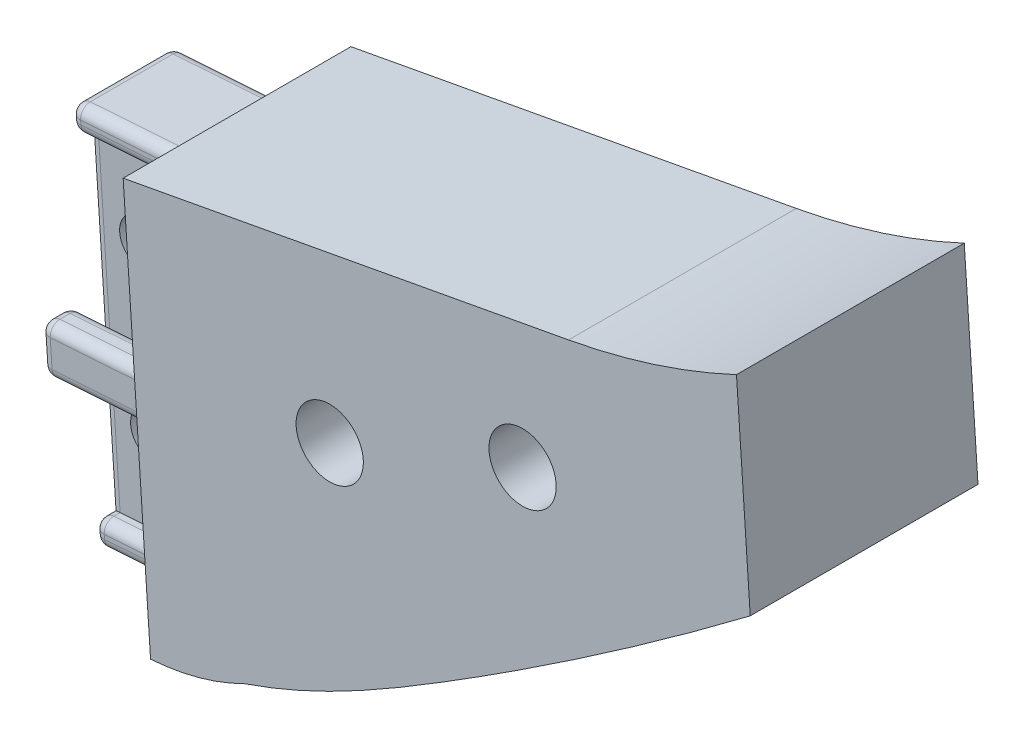
from build123d import *

# Parameters (mm, degrees)
EXTRUDE_1_DEPTH     = 22
SKETCH_2_W          = 6.8
SKETCH_2_H          = 36
SKETCH_2_W_2        = 3
SKETCH_2_H_2        = 4.6
EXTRUDE_2_DEPTH     = 11.3
CUT_EXTRUDE_1_DEPTH = 20
SKETCH_4_R          = 2.25
CUT_EXTRUDE_2_DEPTH = 20
SKETCH_5_W          = 1.6
SKETCH_5_H          = 2.4
EXTRUDE_3_DEPTH     = 11.3
FILLET_1_R          = 1
FILLET_2_R          = 1


with BuildPart() as part:
    # 草图1 → 凸台-拉伸1 (new body)
    with BuildSketch(Plane.XY):
        with BuildLine():
            Line((-45.67470291, -69.525381776), (-46.33853291, -59.768796062))
            Line((-46.33853291, -59.768796062), (-64.634609433, -66.91544134))
            ThreePointArc((-64.634609433, -66.91544134), (-64.468033083, -67.496281171), (-64.411860377, -68.097918284))
            ThreePointArc((-64.411860377, -68.097918284), (-67.060223263, -71.291745578), (-70.68911132, -69.280395229))
            Line((-70.68911132, -69.280395229), (-83.263846009, -74.192222536))
            ThreePointArc((-83.263846009, -74.192222536), (-83.097269659, -74.773062367), (-83.041096953, -75.374699481))
            ThreePointArc((-83.041096953, -75.374699481), (-85.689459839, -78.568526775), (-89.318347897, -76.557176425))
            Line((-89.318347897, -76.557176425), (-104.920333529, -82.651480677))
            Line((-104.920333529, -82.651480677), (-103.596537569, -102.107860688))
            ThreePointArc((-103.596537569, -102.107860688), (-98.935464686, -101.319406189), (-94.522710983, -99.623863303))
            add(Edge.make_bspline(
                [(-94.522710983, -99.623863303), (-94.350413301, -99.565330273), (-94.178323002, -99.505929253), (-92.69861986, -98.987177074), (-91.400233036, -98.477813098), (-88.845034755, -97.380884845), (-87.586146272, -96.792839569), (-85.098419755, -95.553179297), (-83.868933964, -94.901212757), (-80.218918974, -92.877216668), (-77.838192378, -91.438351911), (-75.47271447, -89.973539583)],
                knots=[0, 0, 0, 0, 0.016428629, 0.016428629, 0.141428629, 0.141428629, 0.266428629, 0.266428629, 0.391428629, 0.391428629, 0.641428629, 0.641428629, 0.641428629, 0.641428629], degree=3))
            add(Edge.make_bspline(
                [(-75.47271447, -89.973539583), (-69.114043372, -86.035299041), (-62.877350919, -81.902111218), (-53.019244966, -74.970789332), (-49.323976393, -72.278551115), (-45.67470291, -69.525381776)],
                knots=[0, 0, 0, 0, 0.125, 0.125, 0.201401882, 0.201401882, 0.201401882, 0.201401882], degree=3))
        make_face()
        with BuildLine():
            Line((-46.33853291, -59.768796062), (-47.002362911, -50.012210347))
            add(Edge.make_bspline(
                [(-47.002362911, -50.012210347), (-49.413422482, -51.139640915), (-51.889413625, -52.128282764), (-56.13651362, -53.530307969), (-57.879163461, -54.026452663), (-60.827608618, -54.739002009), (-62.021853835, -54.993542056), (-63.221686051, -55.216067386)],
                knots=[0.829122533, 0.829122533, 0.829122533, 0.829122533, 0.875, 0.875, 0.90625, 0.90625, 0.927296641, 0.927296641, 0.927296641, 0.927296641], degree=3))
            Line((-63.221686051, -55.216067386), (-106.244129489, -63.195100667))
            Line((-106.244129489, -63.195100667), (-104.920333529, -82.651480677))
            Line((-104.920333529, -82.651480677), (-89.318347897, -76.557176425))
            ThreePointArc((-89.318347897, -76.557176425), (-87.473573897, -72.347448537), (-83.263846009, -74.192222536))
            Line((-83.263846009, -74.192222536), (-70.68911132, -69.280395229))
            ThreePointArc((-70.68911132, -69.280395229), (-68.844337321, -65.070667341), (-64.634609433, -66.91544134))
            Line((-64.634609433, -66.91544134), (-46.33853291, -59.768796062))
        make_face()
    extrude(amount=EXTRUDE_1_DEPTH)

    # 草图2 → 凸台-拉伸2 (add)
    with BuildSketch(Plane(origin=(-110.034485921, -7.486655167, 0), x_dir=(0, 0, 1), z_dir=(-0.9976933412560903, -0.06788222752133886, 0))):
        with Locations((11, -75.339968965)):
            Rectangle(SKETCH_2_W, SKETCH_2_H)
        with Locations((18.5, -75.337242964)):
            Rectangle(SKETCH_2_W_2, SKETCH_2_H_2)
        with Locations((3.5, -75.337242964)):
            Rectangle(SKETCH_2_W_2, SKETCH_2_H_2)
    extrude(amount=EXTRUDE_2_DEPTH)

    # 草图3 → 切除-拉伸1 (cut)
    with BuildSketch(Plane(origin=(-121.308420677, -8.253724338, 0), x_dir=(0, 0, 1), z_dir=(-0.9976933412560901, -0.06788222752133916, 0))):
        Polygon((12.5, -72.339968965), (10.433333333, -72.339968965), (11.566666667, -78.339968965), (12.5, -78.339968965), align=None)
        Polygon((11.566666667, -78.339968965), (10.433333333, -72.339968965), (9.5, -72.339968965), (9.5, -78.339968965), align=None)
    extrude(amount=-CUT_EXTRUDE_1_DEPTH, mode=Mode.SUBTRACT)

    # 草图4 → 切除-拉伸2 (cut)
    with BuildSketch(Plane.XY.offset(14.4)):
        with Locations((-110.875766349, -90.876083074)):
            Circle(SKETCH_4_R)
        with Locations((-111.934729099, -75.312066951)):
            Circle(SKETCH_4_R)
    extrude(amount=-CUT_EXTRUDE_2_DEPTH, mode=Mode.SUBTRACT)

    # 草图5 → 凸台-拉伸3 (add)
    with BuildSketch(Plane(origin=(-121.308420677, -8.253724338, 0), x_dir=(0, 0, 1), z_dir=(-0.9976933412560901, -0.06788222752133916, 0))):
        with Locations((15.2, -92.139968965)):
            Rectangle(SKETCH_5_W, SKETCH_5_H)
        with Locations((6.8, -92.139968965)):
            Rectangle(SKETCH_5_W, SKETCH_5_H)
        with Locations((6.8, -58.539968965)):
            Rectangle(SKETCH_5_W, SKETCH_5_H)
        with Locations((15.2, -58.539968965)):
            Rectangle(SKETCH_5_W, SKETCH_5_H)
    extrude(amount=-EXTRUDE_3_DEPTH)

    # 圆角1
    fillet_1_edges = [part.edges().sort_by_distance(p)[0] for p in [
        (-109.498245635, -98.600391243, 16),
        (-109.335328289, -100.994855262, 16),
        (-109.498245635, -98.600391243, 6),
        (-109.335328289, -100.994855262, 6),
        (-111.616171133, -67.472358996, 6),
        (-111.779088479, -65.077894976, 6),
        (-111.779088479, -65.077894976, 16),
        (-111.616171133, -67.472358996, 16),
        (-110.401264308, -85.328350091, 5),
        (-110.713522554, -80.738960722, 5),
        (-110.713522554, -80.738960722, 2),
        (-110.401264308, -85.328350091, 2),
        (-110.401264308, -85.328350091, 17),
        (-110.401264308, -85.328350091, 20),
        (-110.713522554, -80.738960722, 20),
        (-110.713522554, -80.738960722, 17),
        (-106.013595667, -85.734167453, 12.5),
        (-106.013595667, -85.734167453, 9.5),
        (-106.420889032, -79.748007406, 9.5),
        (-106.420889032, -79.748007406, 12.5),
    ]]
    fillet(fillet_1_edges, radius=FILLET_1_R)

    # 圆角2
    # the kernel refuses this fillet: 1 mm, written as the material it takes off along each edge
    with BuildSketch(Plane(origin=(-115.135213013, -98.983925828, 15), x_dir=(0.9976933412560902, 0.06788222752133839, 0), z_dir=(0, 0, -1)), Plane(origin=(-117.253138511, -67.855893581, 14.4), x_dir=(0.9976933412560902, 0.06788222752133742, 0), z_dir=(0, 0, 1)), Plane(origin=(-117.253138511, -67.855893581, 7), x_dir=(0.9976933412560902, 0.06788222752133742, 0), z_dir=(0, 0, 1)), Plane(origin=(-115.135213013, -98.983925828, 7.6), x_dir=(0.9976933412560902, 0.06788222752133839, 0), z_dir=(0, 0, -1))) as fillet_2_piece_1:
        with BuildLine():
            CenterArc((FILLET_2_R, FILLET_2_R), FILLET_2_R, 180, 90)
            Line((0, FILLET_2_R), (-FILLET_2_R * 0.02, FILLET_2_R))
            Line((-FILLET_2_R * 0.02, FILLET_2_R), (-FILLET_2_R * 0.02, -FILLET_2_R * 0.02))
            Line((-FILLET_2_R * 0.02, -FILLET_2_R * 0.02), (FILLET_2_R, -FILLET_2_R * 0.02))
            Line((FILLET_2_R, -FILLET_2_R * 0.02), (FILLET_2_R, 0))
        make_face()
    fillet_2_piece_1_solid = extrude(amount=0.6, mode=Mode.PRIVATE)
    with BuildSketch(Plane(origin=(-115.135213013, -98.983925828, 7.6), x_dir=(0.9976933412560901, 0.06788222752133885, 0), z_dir=(-0.06788222752133886, 0.9976933412560903, 0)), Plane(origin=(-117.253138511, -67.855893581, 14.4), x_dir=(0.9976933412560902, 0.06788222752133886, 0), z_dir=(0.06788222752133886, -0.9976933412560903, 0))) as fillet_2_piece_2:
        with BuildLine():
            CenterArc((FILLET_2_R, -FILLET_2_R), FILLET_2_R, 90, 90)
            Line((0, -FILLET_2_R), (-FILLET_2_R * 0.02, -FILLET_2_R))
            Line((-FILLET_2_R * 0.02, -FILLET_2_R), (-FILLET_2_R * 0.02, FILLET_2_R * 0.02))
            Line((-FILLET_2_R * 0.02, FILLET_2_R * 0.02), (FILLET_2_R, FILLET_2_R * 0.02))
            Line((FILLET_2_R, FILLET_2_R * 0.02), (FILLET_2_R, 0))
        make_face()
    fillet_2_piece_2_solid = extrude(amount=31.2, mode=Mode.PRIVATE)
    with BuildSketch(Plane(origin=(-116.329940217, -81.424523022, 9.5), x_dir=(0, 0, -1), z_dir=(0.06788222752133917, -0.9976933412560902, 0)), Plane(origin=(-116.058411307, -85.415296387, 12.5), x_dir=(0, 0, 1), z_dir=(-0.06788222752133917, 0.9976933412560902, 0))) as fillet_2_piece_3:
        with BuildLine():
            CenterArc((FILLET_2_R, FILLET_2_R), FILLET_2_R, 180, 90)
            Line((0, FILLET_2_R), (-FILLET_2_R * 0.0199999999999, FILLET_2_R))
            Line((-FILLET_2_R * 0.0199999999999, FILLET_2_R), (-FILLET_2_R * 0.02, -FILLET_2_R * 0.02))
            Line((-FILLET_2_R * 0.02, -FILLET_2_R * 0.02), (FILLET_2_R, -FILLET_2_R * 0.02))
            Line((FILLET_2_R, -FILLET_2_R * 0.02), (FILLET_2_R, 0))
        make_face()
    fillet_2_piece_3_solid = extrude(amount=4, mode=Mode.PRIVATE)
    with BuildSketch(Plane(origin=(-116.397822445, -80.426829681, 10.5), x_dir=(-0.0678822275212516, 0.9976933412560962, 0), z_dir=(0, 0, 1)), Plane(origin=(-116.350489932, -81.122495307, 3), x_dir=(0.9976933412560893, 0.06788222752135158, 0), z_dir=(0, 0, 1)), Plane(origin=(-116.038231686, -85.711884677, 4), x_dir=(0.9976933412560893, 0.06788222752135158, 0), z_dir=(0, 0, -1)), Plane(origin=(-116.038231686, -85.711884677, 19), x_dir=(0.9976933412560893, 0.06788222752135158, 0), z_dir=(0, 0, -1)), Plane(origin=(-116.350489932, -81.122495307, 18), x_dir=(0.9976933412560893, 0.06788222752135158, 0), z_dir=(0, 0, 1))) as fillet_2_piece_4:
        with BuildLine():
            CenterArc((FILLET_2_R, -FILLET_2_R), FILLET_2_R, 90, 90)
            Line((0, -FILLET_2_R), (-FILLET_2_R * 0.0199999999999, -FILLET_2_R))
            Line((-FILLET_2_R * 0.0199999999999, -FILLET_2_R), (-FILLET_2_R * 0.02, FILLET_2_R * 0.02))
            Line((-FILLET_2_R * 0.02, FILLET_2_R * 0.02), (FILLET_2_R, FILLET_2_R * 0.02))
            Line((FILLET_2_R, FILLET_2_R * 0.02), (FILLET_2_R, 0))
        make_face()
    fillet_2_piece_4_solid = extrude(amount=1, mode=Mode.PRIVATE)
    with BuildSketch(Plane(origin=(-115.990529079, -86.412989728, 10.5), x_dir=(0.06788222752140816, -0.9976933412560856, 0), z_dir=(0, 0, 1))) as fillet_2_piece_5:
        with BuildLine():
            CenterArc((FILLET_2_R, FILLET_2_R), FILLET_2_R, 180, 90)
            Line((0, FILLET_2_R), (-FILLET_2_R * 0.0199999999999, FILLET_2_R))
            Line((-FILLET_2_R * 0.0199999999999, FILLET_2_R), (-FILLET_2_R * 0.02, -FILLET_2_R * 0.02))
            Line((-FILLET_2_R * 0.02, -FILLET_2_R * 0.02), (FILLET_2_R, -FILLET_2_R * 0.02))
            Line((FILLET_2_R, -FILLET_2_R * 0.02), (FILLET_2_R, 0))
        make_face()
    fillet_2_piece_5_solid = extrude(amount=1, mode=Mode.PRIVATE)
    with BuildSketch(Plane(origin=(-115.040177894, -100.380696506, 16), x_dir=(0.9976933412560902, 0.06788222752133917, 0), z_dir=(-0.06788222752133917, 0.9976933412560902, 0)), Plane(origin=(-117.321020739, -66.85820024, 16), x_dir=(0.9976933412560901, 0.06788222752133916, 0), z_dir=(-0.06788222752133917, 0.9976933412560902, 0)), Plane(origin=(-117.34817363, -66.459122903, 6), x_dir=(0.9976933412560902, 0.06788222752133917, 0), z_dir=(0.06788222752133917, -0.9976933412560902, 0)), Plane(origin=(-115.067330785, -99.981619169, 6), x_dir=(0.9976933412560902, 0.06788222752133917, 0), z_dir=(0.06788222752133917, -0.9976933412560902, 0))) as fillet_2_piece_6:
        with BuildLine():
            CenterArc((FILLET_2_R, FILLET_2_R), FILLET_2_R, 180, 90)
            Line((0, FILLET_2_R), (-FILLET_2_R * 0.02, FILLET_2_R))
            Line((-FILLET_2_R * 0.02, FILLET_2_R), (-FILLET_2_R * 0.02, -FILLET_2_R * 0.02))
            Line((-FILLET_2_R * 0.02, -FILLET_2_R * 0.02), (FILLET_2_R, -FILLET_2_R * 0.02))
            Line((FILLET_2_R, -FILLET_2_R * 0.02), (FILLET_2_R, 0))
        make_face()
    fillet_2_piece_6_solid = extrude(amount=0.4, mode=Mode.PRIVATE)
    with BuildSketch(Plane(origin=(-114.972295667, -101.378389847, 15), x_dir=(0.9976933412560904, 0.06788222752133648, 0), z_dir=(0, 0, -1)), Plane(origin=(-117.416055857, -65.461429562, 7), x_dir=(0.9976933412560884, 0.06788222752136572, 0), z_dir=(0, 0, 1))) as fillet_2_piece_7:
        with BuildLine():
            CenterArc((FILLET_2_R, -FILLET_2_R), FILLET_2_R, 90, 90)
            Line((0, -FILLET_2_R), (-FILLET_2_R * 0.02, -FILLET_2_R))
            Line((-FILLET_2_R * 0.02, -FILLET_2_R), (-FILLET_2_R * 0.02, FILLET_2_R * 0.02))
            Line((-FILLET_2_R * 0.02, FILLET_2_R * 0.02), (FILLET_2_R, FILLET_2_R * 0.02))
            Line((FILLET_2_R, FILLET_2_R * 0.02), (FILLET_2_R, 0))
        make_face()
    fillet_2_piece_7_solid = extrude(amount=8, mode=Mode.PRIVATE)
    with BuildSketch(Plane(origin=(-117.321020739, -66.85820024, 15), x_dir=(0.06788222752133742, -0.9976933412560902, 0), z_dir=(0, 0, -1))) as fillet_2_piece_8:
        with BuildLine():
            CenterArc((1 - FILLET_2_R, -FILLET_2_R), FILLET_2_R, 0, 90)
            Line((1 - FILLET_2_R, 0), (1 - FILLET_2_R, FILLET_2_R * 0.02))
            Line((1 - FILLET_2_R, FILLET_2_R * 0.02), (1, FILLET_2_R * 0.02))
            Line((1, FILLET_2_R * 0.02), (1 + FILLET_2_R * 0.02, 0))
            Line((1 + FILLET_2_R * 0.02, 0), (1 + FILLET_2_R * 0.02, -FILLET_2_R))
            Line((1 + FILLET_2_R * 0.02, -FILLET_2_R), (1, -FILLET_2_R))
        make_face()
    fillet_2_piece_8_solid = revolve(axis=Axis((-117.321020739, -66.85820024, 15), (-0.9976933412560902, -0.06788222752133917, 0)), revolution_arc=90, mode=Mode.PRIVATE)
    with BuildSketch(Plane(origin=(-117.34817363, -66.459122903, 15), x_dir=(-0.06788222752133742, 0.9976933412560902, 0), z_dir=(0, 0, -1))) as fillet_2_piece_9:
        with BuildLine():
            CenterArc((1 - FILLET_2_R, FILLET_2_R), FILLET_2_R, 270, 90)
            Line((1 - FILLET_2_R, 0), (1 - FILLET_2_R, -FILLET_2_R * 0.02))
            Line((1 - FILLET_2_R, -FILLET_2_R * 0.02), (1, -FILLET_2_R * 0.02))
            Line((1, -FILLET_2_R * 0.02), (1 + FILLET_2_R * 0.02, 0))
            Line((1 + FILLET_2_R * 0.02, 0), (1 + FILLET_2_R * 0.02, FILLET_2_R))
            Line((1 + FILLET_2_R * 0.02, FILLET_2_R), (1, FILLET_2_R))
        make_face()
    fillet_2_piece_9_solid = revolve(axis=Axis((-117.34817363, -66.459122903, 15), (0.9976933412560902, 0.06788222752133917, 0)), revolution_arc=90, mode=Mode.PRIVATE)
    with BuildSketch(Plane(origin=(-117.34817363, -66.459122903, 7), x_dir=(0, 0, -1), z_dir=(0.06788222752133917, -0.9976933412560902, -1.4178075122914751e-14))) as fillet_2_piece_10:
        with BuildLine():
            CenterArc((1 - FILLET_2_R, FILLET_2_R), FILLET_2_R, 270, 90)
            Line((1 - FILLET_2_R, 0), (1 - FILLET_2_R, -FILLET_2_R * 0.02))
            Line((1 - FILLET_2_R, -FILLET_2_R * 0.02), (1, -FILLET_2_R * 0.02))
            Line((1, -FILLET_2_R * 0.02), (1 + FILLET_2_R * 0.02, 0))
            Line((1 + FILLET_2_R * 0.02, 0), (1 + FILLET_2_R * 0.02, FILLET_2_R))
            Line((1 + FILLET_2_R * 0.02, FILLET_2_R), (1, FILLET_2_R))
        make_face()
    fillet_2_piece_10_solid = revolve(axis=Axis((-117.34817363, -66.459122903, 7), (0.9976933412560902, 0.06788222752133917, 0)), revolution_arc=90, mode=Mode.PRIVATE)
    with BuildSketch(Plane(origin=(-117.321020739, -66.85820024, 7), x_dir=(0.06788222752133742, -0.9976933412560902, 0), z_dir=(0, 0, 1))) as fillet_2_piece_11:
        with BuildLine():
            CenterArc((1 - FILLET_2_R, FILLET_2_R), FILLET_2_R, 270, 90)
            Line((1 - FILLET_2_R, 0), (1 - FILLET_2_R, -FILLET_2_R * 0.02))
            Line((1 - FILLET_2_R, -FILLET_2_R * 0.02), (1, -FILLET_2_R * 0.02))
            Line((1, -FILLET_2_R * 0.02), (1 + FILLET_2_R * 0.02, 0))
            Line((1 + FILLET_2_R * 0.02, 0), (1 + FILLET_2_R * 0.02, FILLET_2_R))
            Line((1 + FILLET_2_R * 0.02, FILLET_2_R), (1, FILLET_2_R))
        make_face()
    fillet_2_piece_11_solid = revolve(axis=Axis((-117.321020739, -66.85820024, 7), (0.9976933412560902, 0.06788222752133917, 0)), revolution_arc=90, mode=Mode.PRIVATE)
    with BuildSketch(Plane(origin=(-115.067330785, -99.981619169, 7), x_dir=(0, 0, -1), z_dir=(0.06788222752133917, -0.9976933412560902, 0))) as fillet_2_piece_12:
        with BuildLine():
            CenterArc((1 - FILLET_2_R, FILLET_2_R), FILLET_2_R, 270, 90)
            Line((1 - FILLET_2_R, 0), (1 - FILLET_2_R, -FILLET_2_R * 0.02))
            Line((1 - FILLET_2_R, -FILLET_2_R * 0.02), (1, -FILLET_2_R * 0.02))
            Line((1, -FILLET_2_R * 0.02), (1 + FILLET_2_R * 0.02, 0))
            Line((1 + FILLET_2_R * 0.02, 0), (1 + FILLET_2_R * 0.02, FILLET_2_R))
            Line((1 + FILLET_2_R * 0.02, FILLET_2_R), (1, FILLET_2_R))
        make_face()
    fillet_2_piece_12_solid = revolve(axis=Axis((-115.067330785, -99.981619169, 7), (0.9976933412560902, 0.06788222752133917, 0)), revolution_arc=90, mode=Mode.PRIVATE)
    with BuildSketch(Plane(origin=(-115.040177894, -100.380696506, 7), x_dir=(0.06788222752133742, -0.9976933412560902, 0), z_dir=(0, 0, 1))) as fillet_2_piece_13:
        with BuildLine():
            CenterArc((1 - FILLET_2_R, FILLET_2_R), FILLET_2_R, 270, 90)
            Line((1 - FILLET_2_R, 0), (1 - FILLET_2_R, -FILLET_2_R * 0.02))
            Line((1 - FILLET_2_R, -FILLET_2_R * 0.02), (1, -FILLET_2_R * 0.02))
            Line((1, -FILLET_2_R * 0.02), (1 + FILLET_2_R * 0.02, 0))
            Line((1 + FILLET_2_R * 0.02, 0), (1 + FILLET_2_R * 0.02, FILLET_2_R))
            Line((1 + FILLET_2_R * 0.02, FILLET_2_R), (1, FILLET_2_R))
        make_face()
    fillet_2_piece_13_solid = revolve(axis=Axis((-115.040177894, -100.380696506, 7), (0.9976933412560902, 0.06788222752133917, 0)), revolution_arc=90, mode=Mode.PRIVATE)
    with BuildSketch(Plane(origin=(-115.040177894, -100.380696506, 15), x_dir=(0, 0, 1), z_dir=(-0.06788222752133917, 0.9976933412560902, 1.4178075122914751e-14))) as fillet_2_piece_14:
        with BuildLine():
            CenterArc((1 - FILLET_2_R, FILLET_2_R), FILLET_2_R, 270, 90)
            Line((1 - FILLET_2_R, 0), (1 - FILLET_2_R, -FILLET_2_R * 0.02))
            Line((1 - FILLET_2_R, -FILLET_2_R * 0.02), (1, -FILLET_2_R * 0.02))
            Line((1, -FILLET_2_R * 0.02), (1 + FILLET_2_R * 0.02, 0))
            Line((1 + FILLET_2_R * 0.02, 0), (1 + FILLET_2_R * 0.02, FILLET_2_R))
            Line((1 + FILLET_2_R * 0.02, FILLET_2_R), (1, FILLET_2_R))
        make_face()
    fillet_2_piece_14_solid = revolve(axis=Axis((-115.040177894, -100.380696506, 15), (0.9976933412560902, 0.06788222752133917, 0)), revolution_arc=90, mode=Mode.PRIVATE)
    with BuildSketch(Plane(origin=(-115.067330785, -99.981619169, 15), x_dir=(-0.06788222752133742, 0.9976933412560902, 0), z_dir=(0, 0, -1))) as fillet_2_piece_15:
        with BuildLine():
            CenterArc((1 - FILLET_2_R, FILLET_2_R), FILLET_2_R, 270, 90)
            Line((1 - FILLET_2_R, 0), (1 - FILLET_2_R, -FILLET_2_R * 0.02))
            Line((1 - FILLET_2_R, -FILLET_2_R * 0.02), (1, -FILLET_2_R * 0.02))
            Line((1, -FILLET_2_R * 0.02), (1 + FILLET_2_R * 0.02, 0))
            Line((1 + FILLET_2_R * 0.02, 0), (1 + FILLET_2_R * 0.02, FILLET_2_R))
            Line((1 + FILLET_2_R * 0.02, FILLET_2_R), (1, FILLET_2_R))
        make_face()
    fillet_2_piece_15_solid = revolve(axis=Axis((-115.067330785, -99.981619169, 15), (0.9976933412560902, 0.06788222752133917, 0)), revolution_arc=90, mode=Mode.PRIVATE)
    with BuildSketch(Plane(origin=(-116.282607705, -82.120188648, 5), x_dir=(0.9976933412560902, 0.06788222752133885, 0), z_dir=(0.06788222752133886, -0.9976933412560903, 0)), Plane(origin=(-116.106113913, -84.714191336, 2), x_dir=(0.9976933412560902, 0.06788222752133886, 0), z_dir=(-0.06788222752133886, 0.9976933412560903, 0)), Plane(origin=(-116.106113913, -84.714191336, 17), x_dir=(0.9976933412560902, 0.06788222752133886, 0), z_dir=(-0.06788222752133886, 0.9976933412560903, 0)), Plane(origin=(-116.282607705, -82.120188648, 20), x_dir=(0.9976933412560902, 0.06788222752133885, 0), z_dir=(0.06788222752133886, -0.9976933412560903, 0))) as fillet_2_piece_16:
        with BuildLine():
            CenterArc((FILLET_2_R, -FILLET_2_R), FILLET_2_R, 90, 90)
            Line((0, -FILLET_2_R), (-FILLET_2_R * 0.02, -FILLET_2_R))
            Line((-FILLET_2_R * 0.02, -FILLET_2_R), (-FILLET_2_R * 0.02, FILLET_2_R * 0.02))
            Line((-FILLET_2_R * 0.02, FILLET_2_R * 0.02), (FILLET_2_R, FILLET_2_R * 0.02))
            Line((FILLET_2_R, FILLET_2_R * 0.02), (FILLET_2_R, 0))
        make_face()
    fillet_2_piece_16_solid = extrude(amount=2.6, mode=Mode.PRIVATE)
    with BuildSketch(Plane(origin=(-116.282607705, -82.120188648, 3), x_dir=(0, 0, -1), z_dir=(0.06788222752133886, -0.9976933412560902, 0))) as fillet_2_piece_17:
        with BuildLine():
            CenterArc((1 - FILLET_2_R, FILLET_2_R), FILLET_2_R, 270, 90)
            Line((1 - FILLET_2_R, 0), (1 - FILLET_2_R, -FILLET_2_R * 0.02))
            Line((1 - FILLET_2_R, -FILLET_2_R * 0.02), (1, -FILLET_2_R * 0.02))
            Line((1, -FILLET_2_R * 0.02), (1 + FILLET_2_R * 0.02, 0))
            Line((1 + FILLET_2_R * 0.02, 0), (1 + FILLET_2_R * 0.02, FILLET_2_R))
            Line((1 + FILLET_2_R * 0.02, FILLET_2_R), (1, FILLET_2_R))
        make_face()
    fillet_2_piece_17_solid = revolve(axis=Axis((-116.282607705, -82.120188648, 3), (0.9976933412560902, 0.06788222752133886, 0)), revolution_arc=90, mode=Mode.PRIVATE)
    with BuildSketch(Plane(origin=(-116.106113913, -84.714191336, 3), x_dir=(0, 0, -1), z_dir=(-0.06788222752133886, 0.9976933412560902, 0))) as fillet_2_piece_18:
        with BuildLine():
            CenterArc((1 - FILLET_2_R, -FILLET_2_R), FILLET_2_R, 0, 90)
            Line((1 - FILLET_2_R, 0), (1 - FILLET_2_R, FILLET_2_R * 0.02))
            Line((1 - FILLET_2_R, FILLET_2_R * 0.02), (1, FILLET_2_R * 0.02))
            Line((1, FILLET_2_R * 0.02), (1 + FILLET_2_R * 0.02, 0))
            Line((1 + FILLET_2_R * 0.02, 0), (1 + FILLET_2_R * 0.02, -FILLET_2_R))
            Line((1 + FILLET_2_R * 0.02, -FILLET_2_R), (1, -FILLET_2_R))
        make_face()
    fillet_2_piece_18_solid = revolve(axis=Axis((-116.106113913, -84.714191336, 3), (-0.9976933412560902, -0.06788222752133886, 0)), revolution_arc=90, mode=Mode.PRIVATE)
    with BuildSketch(Plane(origin=(-116.106113913, -84.714191336, 4), x_dir=(0, 0, 1), z_dir=(-0.06788222752133886, 0.9976933412560902, 0))) as fillet_2_piece_19:
        with BuildLine():
            CenterArc((1 - FILLET_2_R, FILLET_2_R), FILLET_2_R, 270, 90)
            Line((1 - FILLET_2_R, 0), (1 - FILLET_2_R, -FILLET_2_R * 0.02))
            Line((1 - FILLET_2_R, -FILLET_2_R * 0.02), (1, -FILLET_2_R * 0.02))
            Line((1, -FILLET_2_R * 0.02), (1 + FILLET_2_R * 0.02, 0))
            Line((1 + FILLET_2_R * 0.02, 0), (1 + FILLET_2_R * 0.02, FILLET_2_R))
            Line((1 + FILLET_2_R * 0.02, FILLET_2_R), (1, FILLET_2_R))
        make_face()
    fillet_2_piece_19_solid = revolve(axis=Axis((-116.106113913, -84.714191336, 4), (0.9976933412560902, 0.06788222752133886, 0)), revolution_arc=90, mode=Mode.PRIVATE)
    with BuildSketch(Plane(origin=(-116.282607705, -82.120188648, 4), x_dir=(-0.06788222752133742, 0.9976933412560902, 0), z_dir=(0, 0, -1))) as fillet_2_piece_20:
        with BuildLine():
            CenterArc((1 - FILLET_2_R, FILLET_2_R), FILLET_2_R, 270, 90)
            Line((1 - FILLET_2_R, 0), (1 - FILLET_2_R, -FILLET_2_R * 0.02))
            Line((1 - FILLET_2_R, -FILLET_2_R * 0.02), (1, -FILLET_2_R * 0.02))
            Line((1, -FILLET_2_R * 0.02), (1 + FILLET_2_R * 0.02, 0))
            Line((1 + FILLET_2_R * 0.02, 0), (1 + FILLET_2_R * 0.02, FILLET_2_R))
            Line((1 + FILLET_2_R * 0.02, FILLET_2_R), (1, FILLET_2_R))
        make_face()
    fillet_2_piece_20_solid = revolve(axis=Axis((-116.282607705, -82.120188648, 4), (0.9976933412560902, 0.06788222752133886, 0)), revolution_arc=90, mode=Mode.PRIVATE)
    with BuildSketch(Plane(origin=(-116.282607705, -82.120188648, 19), x_dir=(0, 0, 1), z_dir=(0.06788222752133886, -0.9976933412560902, -1.4178075122914751e-14))) as fillet_2_piece_21:
        with BuildLine():
            CenterArc((1 - FILLET_2_R, -FILLET_2_R), FILLET_2_R, 0, 90)
            Line((1 - FILLET_2_R, 0), (1 - FILLET_2_R, FILLET_2_R * 0.02))
            Line((1 - FILLET_2_R, FILLET_2_R * 0.02), (1, FILLET_2_R * 0.02))
            Line((1, FILLET_2_R * 0.02), (1 + FILLET_2_R * 0.02, 0))
            Line((1 + FILLET_2_R * 0.02, 0), (1 + FILLET_2_R * 0.02, -FILLET_2_R))
            Line((1 + FILLET_2_R * 0.02, -FILLET_2_R), (1, -FILLET_2_R))
        make_face()
    fillet_2_piece_21_solid = revolve(axis=Axis((-116.282607705, -82.120188648, 19), (-0.9976933412560902, -0.06788222752133886, 0)), revolution_arc=90, mode=Mode.PRIVATE)
    with BuildSketch(Plane(origin=(-116.106113913, -84.714191336, 19), x_dir=(0, 0, 1), z_dir=(-0.06788222752133886, 0.9976933412560902, 0))) as fillet_2_piece_22:
        with BuildLine():
            CenterArc((1 - FILLET_2_R, FILLET_2_R), FILLET_2_R, 270, 90)
            Line((1 - FILLET_2_R, 0), (1 - FILLET_2_R, -FILLET_2_R * 0.02))
            Line((1 - FILLET_2_R, -FILLET_2_R * 0.02), (1, -FILLET_2_R * 0.02))
            Line((1, -FILLET_2_R * 0.02), (1 + FILLET_2_R * 0.02, 0))
            Line((1 + FILLET_2_R * 0.02, 0), (1 + FILLET_2_R * 0.02, FILLET_2_R))
            Line((1 + FILLET_2_R * 0.02, FILLET_2_R), (1, FILLET_2_R))
        make_face()
    fillet_2_piece_22_solid = revolve(axis=Axis((-116.106113913, -84.714191336, 19), (0.9976933412560902, 0.06788222752133886, 0)), revolution_arc=90, mode=Mode.PRIVATE)
    with BuildSketch(Plane(origin=(-116.282607705, -82.120188648, 18), x_dir=(0, 0, -1), z_dir=(0.06788222752133886, -0.9976933412560902, 0))) as fillet_2_piece_23:
        with BuildLine():
            CenterArc((1 - FILLET_2_R, FILLET_2_R), FILLET_2_R, 270, 90)
            Line((1 - FILLET_2_R, 0), (1 - FILLET_2_R, -FILLET_2_R * 0.02))
            Line((1 - FILLET_2_R, -FILLET_2_R * 0.02), (1, -FILLET_2_R * 0.02))
            Line((1, -FILLET_2_R * 0.02), (1 + FILLET_2_R * 0.02, 0))
            Line((1 + FILLET_2_R * 0.02, 0), (1 + FILLET_2_R * 0.02, FILLET_2_R))
            Line((1 + FILLET_2_R * 0.02, FILLET_2_R), (1, FILLET_2_R))
        make_face()
    fillet_2_piece_23_solid = revolve(axis=Axis((-116.282607705, -82.120188648, 18), (0.9976933412560902, 0.06788222752133886, 0)), revolution_arc=90, mode=Mode.PRIVATE)
    with BuildSketch(Plane(origin=(-116.106113913, -84.714191336, 18), x_dir=(0.06788222752133742, -0.9976933412560902, 0), z_dir=(0, 0, 1))) as fillet_2_piece_24:
        with BuildLine():
            CenterArc((1 - FILLET_2_R, FILLET_2_R), FILLET_2_R, 270, 90)
            Line((1 - FILLET_2_R, 0), (1 - FILLET_2_R, -FILLET_2_R * 0.02))
            Line((1 - FILLET_2_R, -FILLET_2_R * 0.02), (1, -FILLET_2_R * 0.02))
            Line((1, -FILLET_2_R * 0.02), (1 + FILLET_2_R * 0.02, 0))
            Line((1 + FILLET_2_R * 0.02, 0), (1 + FILLET_2_R * 0.02, FILLET_2_R))
            Line((1 + FILLET_2_R * 0.02, FILLET_2_R), (1, FILLET_2_R))
        make_face()
    fillet_2_piece_24_solid = revolve(axis=Axis((-116.106113913, -84.714191336, 18), (0.9976933412560902, 0.06788222752133886, 0)), revolution_arc=90, mode=Mode.PRIVATE)
    with BuildSketch(Plane(origin=(-116.329940217, -81.424523022, 10.5), x_dir=(0, 0, -1), z_dir=(0.06788222752133917, -0.9976933412560902, -1.4178075122914751e-14))) as fillet_2_piece_25:
        with BuildLine():
            CenterArc((1 + FILLET_2_R, FILLET_2_R), FILLET_2_R, 180, 90)
            Line((1, FILLET_2_R), (1 - FILLET_2_R * 0.02, FILLET_2_R))
            Line((1 - FILLET_2_R * 0.02, FILLET_2_R), (1 - FILLET_2_R * 0.02, -FILLET_2_R * 0.02))
            Line((1 - FILLET_2_R * 0.02, -FILLET_2_R * 0.02), (1 + FILLET_2_R, -FILLET_2_R * 0.02))
            Line((1 + FILLET_2_R, -FILLET_2_R * 0.02), (1 + FILLET_2_R, 0))
        make_face()
    fillet_2_piece_25_solid = revolve(axis=Axis((-116.329940217, -81.424523022, 10.5), (0.9976933412560902, 0.06788222752133917, 0)), revolution_arc=90, mode=Mode.PRIVATE)
    with BuildSketch(Plane(origin=(-116.329940217, -81.424523022, 11.5), x_dir=(0, 0, 1), z_dir=(0.06788222752133917, -0.9976933412560902, 0))) as fillet_2_piece_26:
        with BuildLine():
            CenterArc((1 + FILLET_2_R, -FILLET_2_R), FILLET_2_R, 90, 90)
            Line((1, -FILLET_2_R), (1 - FILLET_2_R * 0.02, -FILLET_2_R))
            Line((1 - FILLET_2_R * 0.02, -FILLET_2_R), (1 - FILLET_2_R * 0.02, FILLET_2_R * 0.02))
            Line((1 - FILLET_2_R * 0.02, FILLET_2_R * 0.02), (1 + FILLET_2_R, FILLET_2_R * 0.02))
            Line((1 + FILLET_2_R, FILLET_2_R * 0.02), (1 + FILLET_2_R, 0))
        make_face()
    fillet_2_piece_26_solid = revolve(axis=Axis((-116.329940217, -81.424523022, 11.5), (-0.9976933412560902, -0.06788222752133917, 0)), revolution_arc=90, mode=Mode.PRIVATE)
    with BuildSketch(Plane(origin=(-116.058411307, -85.415296387, 10.5), x_dir=(0.06788222752133742, -0.9976933412560902, 0), z_dir=(0, 0, 1))) as fillet_2_piece_27:
        with BuildLine():
            CenterArc((1 + FILLET_2_R, FILLET_2_R), FILLET_2_R, 180, 90)
            Line((1, FILLET_2_R), (1 - FILLET_2_R * 0.02, FILLET_2_R))
            Line((1 - FILLET_2_R * 0.02, FILLET_2_R), (1 - FILLET_2_R * 0.02, -FILLET_2_R * 0.02))
            Line((1 - FILLET_2_R * 0.02, -FILLET_2_R * 0.02), (1 + FILLET_2_R, -FILLET_2_R * 0.02))
            Line((1 + FILLET_2_R, -FILLET_2_R * 0.02), (1 + FILLET_2_R, 0))
        make_face()
    fillet_2_piece_27_solid = revolve(axis=Axis((-116.058411307, -85.415296387, 10.5), (0.9976933412560902, 0.06788222752133917, 0)), revolution_arc=90, mode=Mode.PRIVATE)
    with BuildSketch(Plane(origin=(-116.058411307, -85.415296387, 11.5), x_dir=(0, 0, 1), z_dir=(-0.06788222752133917, 0.9976933412560902, 0))) as fillet_2_piece_28:
        with BuildLine():
            CenterArc((1 + FILLET_2_R, FILLET_2_R), FILLET_2_R, 180, 90)
            Line((1, FILLET_2_R), (1 - FILLET_2_R * 0.02, FILLET_2_R))
            Line((1 - FILLET_2_R * 0.02, FILLET_2_R), (1 - FILLET_2_R * 0.02, -FILLET_2_R * 0.02))
            Line((1 - FILLET_2_R * 0.02, -FILLET_2_R * 0.02), (1 + FILLET_2_R, -FILLET_2_R * 0.02))
            Line((1 + FILLET_2_R, -FILLET_2_R * 0.02), (1 + FILLET_2_R, 0))
        make_face()
    fillet_2_piece_28_solid = revolve(axis=Axis((-116.058411307, -85.415296387, 11.5), (0.9976933412560902, 0.06788222752133917, 0)), revolution_arc=90, mode=Mode.PRIVATE)
    with BuildSketch(Plane(origin=(-117.253138511, -67.855893581, 14.4), x_dir=(0.9976933412560902, 0.06788222752133886, 0), z_dir=(0.06788222752133886, -0.9976933412560903, 0))) as fillet_2_piece_29a_section:
        with BuildLine():
            CenterArc((FILLET_2_R, -FILLET_2_R), FILLET_2_R, 90, 90)
            Line((0, -FILLET_2_R), (-FILLET_2_R * 0.02, -FILLET_2_R))
            Line((-FILLET_2_R * 0.02, -FILLET_2_R), (-FILLET_2_R * 0.02, FILLET_2_R * 0.02))
            Line((-FILLET_2_R * 0.02, FILLET_2_R * 0.02), (FILLET_2_R, FILLET_2_R * 0.02))
            Line((FILLET_2_R, FILLET_2_R * 0.02), (FILLET_2_R, 0))
        make_face()
    fillet_2_piece_29a = extrude(amount=33.7, mode=Mode.PRIVATE)
    fillet_2_piece_29a = split(fillet_2_piece_29a, bisect_by=Plane(origin=(-114.909340115, -98.968557624, 14.173604886), z_dir=(0.06788222752133917, -0.9976933412560902, 0)), keep=Keep.TOP, mode=Mode.PRIVATE)
    with BuildSketch(Plane(origin=(-115.135213013, -98.983925828, 15), x_dir=(0.9976933412560902, 0.06788222752133839, 0), z_dir=(0, 0, -1))) as fillet_2_piece_29b_section:
        with BuildLine():
            CenterArc((FILLET_2_R, FILLET_2_R), FILLET_2_R, 180, 90)
            Line((0, FILLET_2_R), (-FILLET_2_R * 0.02, FILLET_2_R))
            Line((-FILLET_2_R * 0.02, FILLET_2_R), (-FILLET_2_R * 0.02, -FILLET_2_R * 0.02))
            Line((-FILLET_2_R * 0.02, -FILLET_2_R * 0.02), (FILLET_2_R, -FILLET_2_R * 0.02))
            Line((FILLET_2_R, -FILLET_2_R * 0.02), (FILLET_2_R, 0))
        make_face()
    fillet_2_piece_29b = extrude(amount=3.1, mode=Mode.PRIVATE)
    fillet_2_piece_29b = split(fillet_2_piece_29b, bisect_by=Plane(origin=(-114.89397191, -99.194430522, 14.4), z_dir=(0, 0, -1)), keep=Keep.TOP, mode=Mode.PRIVATE)
    fillet_2_piece_29 = fillet_2_piece_29a & fillet_2_piece_29b
    with BuildSketch(Plane(origin=(-114.965507444, -101.478159181, 7.6), x_dir=(0.9976933412560902, 0.06788222752133885, 0), z_dir=(-0.06788222752133886, 0.9976933412560903, 0))) as fillet_2_piece_30a_section:
        with BuildLine():
            CenterArc((FILLET_2_R, -FILLET_2_R), FILLET_2_R, 90, 90)
            Line((0, -FILLET_2_R), (-FILLET_2_R * 0.02, -FILLET_2_R))
            Line((-FILLET_2_R * 0.02, -FILLET_2_R), (-FILLET_2_R * 0.02, FILLET_2_R * 0.02))
            Line((-FILLET_2_R * 0.02, FILLET_2_R * 0.02), (FILLET_2_R, FILLET_2_R * 0.02))
            Line((FILLET_2_R, FILLET_2_R * 0.02), (FILLET_2_R, 0))
        make_face()
    fillet_2_piece_30a = extrude(amount=33.7, mode=Mode.PRIVATE)
    fillet_2_piece_30a = split(fillet_2_piece_30a, bisect_by=Plane(origin=(-114.909340115, -98.968557624, 7.826395114), z_dir=(0.06788222752133917, -0.9976933412560902, 0)), keep=Keep.TOP, mode=Mode.PRIVATE)
    with BuildSketch(Plane(origin=(-115.135213013, -98.983925828, 10.1), x_dir=(0.9976933412560902, 0.06788222752133839, 0), z_dir=(0, 0, -1))) as fillet_2_piece_30b_section:
        with BuildLine():
            CenterArc((FILLET_2_R, FILLET_2_R), FILLET_2_R, 180, 90)
            Line((0, FILLET_2_R), (-FILLET_2_R * 0.02, FILLET_2_R))
            Line((-FILLET_2_R * 0.02, FILLET_2_R), (-FILLET_2_R * 0.02, -FILLET_2_R * 0.02))
            Line((-FILLET_2_R * 0.02, -FILLET_2_R * 0.02), (FILLET_2_R, -FILLET_2_R * 0.02))
            Line((FILLET_2_R, -FILLET_2_R * 0.02), (FILLET_2_R, 0))
        make_face()
    fillet_2_piece_30b = extrude(amount=3.1, mode=Mode.PRIVATE)
    fillet_2_piece_30b = split(fillet_2_piece_30b, bisect_by=Plane(origin=(-114.89397191, -99.194430522, 7.6), z_dir=(0, 0, 1)), keep=Keep.TOP, mode=Mode.PRIVATE)
    fillet_2_piece_30 = fillet_2_piece_30a & fillet_2_piece_30b
    with BuildSketch(Plane(origin=(-117.253138511, -67.855893581, 7), x_dir=(0.9976933412560902, 0.06788222752133742, 0), z_dir=(0, 0, 1))) as fillet_2_piece_31a_section:
        with BuildLine():
            CenterArc((FILLET_2_R, FILLET_2_R), FILLET_2_R, 180, 90)
            Line((0, FILLET_2_R), (-FILLET_2_R * 0.02, FILLET_2_R))
            Line((-FILLET_2_R * 0.02, FILLET_2_R), (-FILLET_2_R * 0.02, -FILLET_2_R * 0.02))
            Line((-FILLET_2_R * 0.02, -FILLET_2_R * 0.02), (FILLET_2_R, -FILLET_2_R * 0.02))
            Line((FILLET_2_R, -FILLET_2_R * 0.02), (FILLET_2_R, 0))
        make_face()
    fillet_2_piece_31a = extrude(amount=3.1, mode=Mode.PRIVATE)
    fillet_2_piece_31a = split(fillet_2_piece_31a, bisect_by=Plane(origin=(-117.042633818, -67.614652478, 7.6), z_dir=(0, 0, 1)), keep=Keep.TOP, mode=Mode.PRIVATE)
    with BuildSketch(Plane(origin=(-115.135213013, -98.983925828, 7.6), x_dir=(0.9976933412560901, 0.06788222752133885, 0), z_dir=(-0.06788222752133886, 0.9976933412560903, 0))) as fillet_2_piece_31b_section:
        with BuildLine():
            CenterArc((FILLET_2_R, -FILLET_2_R), FILLET_2_R, 90, 90)
            Line((0, -FILLET_2_R), (-FILLET_2_R * 0.02, -FILLET_2_R))
            Line((-FILLET_2_R * 0.02, -FILLET_2_R), (-FILLET_2_R * 0.02, FILLET_2_R * 0.02))
            Line((-FILLET_2_R * 0.02, FILLET_2_R * 0.02), (FILLET_2_R, FILLET_2_R * 0.02))
            Line((FILLET_2_R, FILLET_2_R * 0.02), (FILLET_2_R, 0))
        make_face()
    fillet_2_piece_31b = extrude(amount=33.7, mode=Mode.PRIVATE)
    fillet_2_piece_31b = split(fillet_2_piece_31b, bisect_by=Plane(origin=(-117.027265613, -67.840525376, 7.826395114), z_dir=(-0.06788222752133917, 0.9976933412560902, 0)), keep=Keep.TOP, mode=Mode.PRIVATE)
    fillet_2_piece_31 = fillet_2_piece_31a & fillet_2_piece_31b
    with BuildSketch(Plane(origin=(-117.253138511, -67.855893581, 11.9), x_dir=(0.9976933412560902, 0.06788222752133742, 0), z_dir=(0, 0, 1))) as fillet_2_piece_32a_section:
        with BuildLine():
            CenterArc((FILLET_2_R, FILLET_2_R), FILLET_2_R, 180, 90)
            Line((0, FILLET_2_R), (-FILLET_2_R * 0.02, FILLET_2_R))
            Line((-FILLET_2_R * 0.02, FILLET_2_R), (-FILLET_2_R * 0.02, -FILLET_2_R * 0.02))
            Line((-FILLET_2_R * 0.02, -FILLET_2_R * 0.02), (FILLET_2_R, -FILLET_2_R * 0.02))
            Line((FILLET_2_R, -FILLET_2_R * 0.02), (FILLET_2_R, 0))
        make_face()
    fillet_2_piece_32a = extrude(amount=3.1, mode=Mode.PRIVATE)
    fillet_2_piece_32a = split(fillet_2_piece_32a, bisect_by=Plane(origin=(-117.042633818, -67.614652478, 14.4), z_dir=(0, 0, -1)), keep=Keep.TOP, mode=Mode.PRIVATE)
    with BuildSketch(Plane(origin=(-117.42284408, -65.361660228, 14.4), x_dir=(0.9976933412560901, 0.06788222752133885, 0), z_dir=(0.06788222752133886, -0.9976933412560903, 0))) as fillet_2_piece_32b_section:
        with BuildLine():
            CenterArc((FILLET_2_R, -FILLET_2_R), FILLET_2_R, 90, 90)
            Line((0, -FILLET_2_R), (-FILLET_2_R * 0.02, -FILLET_2_R))
            Line((-FILLET_2_R * 0.02, -FILLET_2_R), (-FILLET_2_R * 0.02, FILLET_2_R * 0.02))
            Line((-FILLET_2_R * 0.02, FILLET_2_R * 0.02), (FILLET_2_R, FILLET_2_R * 0.02))
            Line((FILLET_2_R, FILLET_2_R * 0.02), (FILLET_2_R, 0))
        make_face()
    fillet_2_piece_32b = extrude(amount=33.7, mode=Mode.PRIVATE)
    fillet_2_piece_32b = split(fillet_2_piece_32b, bisect_by=Plane(origin=(-117.027265613, -67.840525376, 14.173604886), z_dir=(-0.06788222752133917, 0.9976933412560902, 0)), keep=Keep.TOP, mode=Mode.PRIVATE)
    fillet_2_piece_32 = fillet_2_piece_32a & fillet_2_piece_32b
    add([fillet_2_piece_1_solid, fillet_2_piece_2_solid, fillet_2_piece_3_solid, fillet_2_piece_4_solid, fillet_2_piece_5_solid, fillet_2_piece_6_solid, fillet_2_piece_7_solid, fillet_2_piece_8_solid, fillet_2_piece_9_solid, fillet_2_piece_10_solid, fillet_2_piece_11_solid, fillet_2_piece_12_solid, fillet_2_piece_13_solid, fillet_2_piece_14_solid, fillet_2_piece_15_solid, fillet_2_piece_16_solid, fillet_2_piece_17_solid, fillet_2_piece_18_solid, fillet_2_piece_19_solid, fillet_2_piece_20_solid, fillet_2_piece_21_solid, fillet_2_piece_22_solid, fillet_2_piece_23_solid, fillet_2_piece_24_solid, fillet_2_piece_25_solid, fillet_2_piece_26_solid, fillet_2_piece_27_solid, fillet_2_piece_28_solid, fillet_2_piece_29, fillet_2_piece_30, fillet_2_piece_31, fillet_2_piece_32], mode=Mode.SUBTRACT)


solid = part.part
